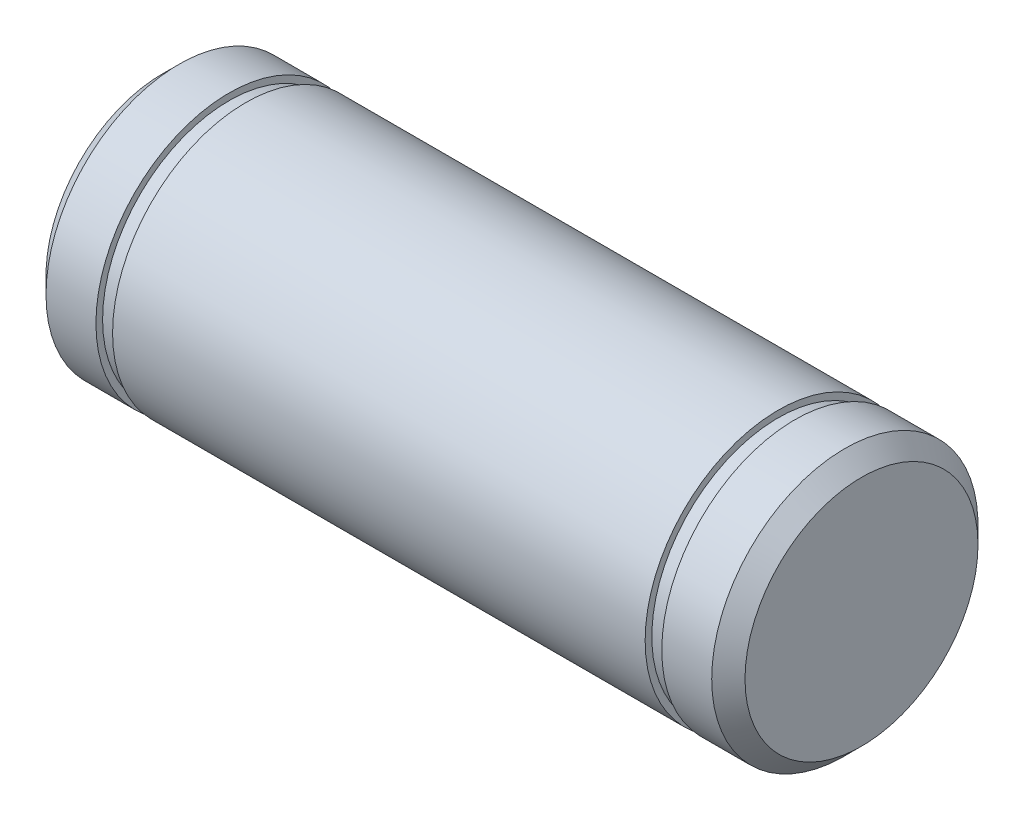
from build123d import *

# Parameters (mm, degrees)
SKETCH1_R           = 2
BOSS_EXTRUDE1_DEPTH = 10.5
CUT_EXTRUDE2_START  = -1
SKETCH2_R           = 2.498108329
SKETCH2_R_2         = 1.9
CUT_EXTRUDE2_DEPTH  = 0.25
CUT_EXTRUDE3_START  = -1.25
SKETCH3_R           = 2.5
SKETCH3_R_2         = 1.9
CUT_EXTRUDE3_DEPTH  = 0.25
CHAMFER1_SIZE       = 0.25


with BuildPart() as part:
    # Sketch1 → Boss-Extrude1 (new body)
    with BuildSketch(Plane(origin=(0, 0, 0), x_dir=(0, 0, -1), z_dir=(1, 0, 0))):
        Circle(SKETCH1_R)
    extrude(amount=BOSS_EXTRUDE1_DEPTH)

    # Sketch2 → Cut-Extrude2 (cut)
    with BuildSketch(Plane(origin=(10.5, 0, 0), x_dir=(0, 0, -1), z_dir=(1, 0, 0)).offset(CUT_EXTRUDE2_START)):
        Circle(SKETCH2_R)
        Circle(SKETCH2_R_2, mode=Mode.SUBTRACT)
    extrude(amount=-CUT_EXTRUDE2_DEPTH, mode=Mode.SUBTRACT)

    # Sketch3 → Cut-Extrude3 (cut)
    with BuildSketch(Plane.ZY.offset(CUT_EXTRUDE3_START)):
        Circle(SKETCH3_R)
        Circle(SKETCH3_R_2, mode=Mode.SUBTRACT)
    extrude(amount=CUT_EXTRUDE3_DEPTH, mode=Mode.SUBTRACT)

    # Chamfer1
    chamfer1_edges = [part.edges().sort_by_distance(p)[0] for p in [
        (0, 0, 2),
        (10.5, 0, 2),
    ]]
    chamfer(chamfer1_edges, length=CHAMFER1_SIZE)


solid = part.part
